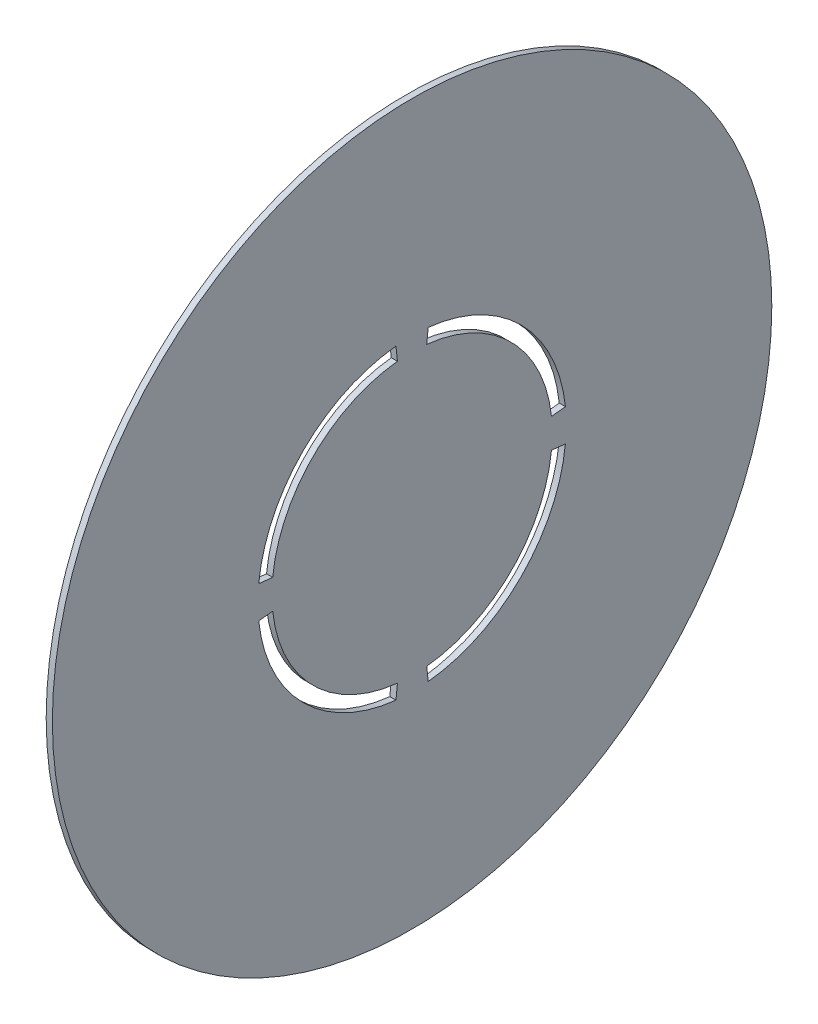
from build123d import *

# Parameters (mm, degrees)
SKETCH1_R           = 48.895
SKETCH1_R_2         = 20.955
BOSS_EXTRUDE1_DEPTH = 0.8382
BOSS_EXTRUDE2_DEPTH = 0.8382


with BuildPart() as part:
    # Sketch1 → Boss-Extrude1 (new body)
    with BuildSketch(Plane(origin=(0, 0, 0), x_dir=(0, 0, -1), z_dir=(1, 0, 0))):
        Circle(SKETCH1_R)
        Circle(SKETCH1_R_2, mode=Mode.SUBTRACT)
    extrude(amount=BOSS_EXTRUDE1_DEPTH)

    # Sketch2 → Boss-Extrude2 (add)
    with BuildSketch(Plane(origin=(0, 0, 0), x_dir=(0, 0, -1), z_dir=(1, 0, 0))):
        with BuildLine():
            Line((-2.190393948, 20.840206317), (-1.991267225, 18.945642107))
            ThreePointArc((-1.991267225, 18.945642107), (-13.470384182, 13.470384182), (-18.945642107, 1.991267225))
            Line((-18.945642107, 1.991267225), (-20.840206317, 2.190393948))
            ThreePointArc((-20.840206317, 2.190393948), (-20.955, 0), (-20.840206317, -2.190393948))
            Line((-20.840206317, -2.190393948), (-18.945642107, -1.991267225))
            ThreePointArc((-18.945642107, -1.991267225), (-13.470384182, -13.470384182), (-1.991267225, -18.945642107))
            Line((-1.991267225, -18.945642107), (-2.190393948, -20.840206317))
            ThreePointArc((-2.190393948, -20.840206317), (0, -20.955), (2.190393948, -20.840206317))
            Line((2.190393948, -20.840206317), (1.991267225, -18.945642107))
            ThreePointArc((1.991267225, -18.945642107), (13.470384182, -13.470384182), (18.945642107, -1.991267225))
            Line((18.945642107, -1.991267225), (20.840206317, -2.190393948))
            ThreePointArc((20.840206317, -2.190393948), (20.955, 0), (20.840206317, 2.190393948))
            Line((20.840206317, 2.190393948), (18.945642107, 1.991267225))
            ThreePointArc((18.945642107, 1.991267225), (13.470384182, 13.470384182), (1.991267225, 18.945642107))
            Line((1.991267225, 18.945642107), (2.190393948, 20.840206317))
            ThreePointArc((2.190393948, 20.840206317), (0, 20.955), (-2.190393948, 20.840206317))
        make_face()
    extrude(amount=BOSS_EXTRUDE2_DEPTH)


solid = part.part
